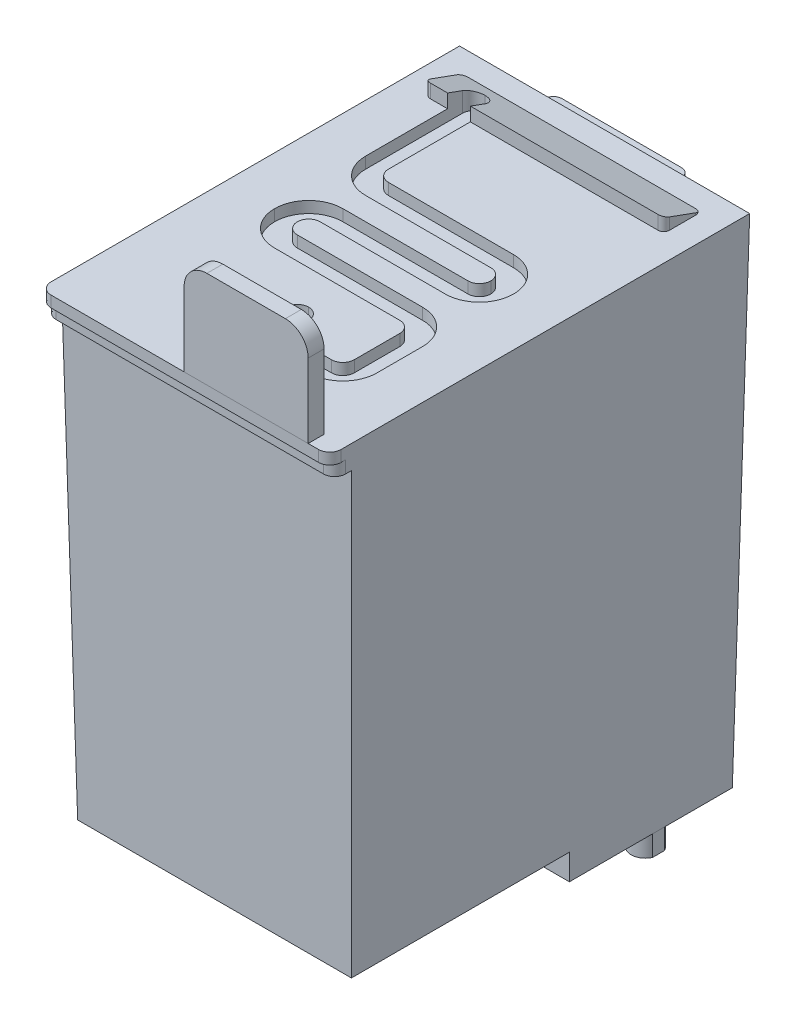
from build123d import *

# Parameters (mm, degrees)
SKETCH1_W                       = 25.5
SKETCH1_H                       = 35
BOSS_EXTRUDE1_DEPTH             = 41.4
BOSS_EXTRUDE1_DRAFT             = -1
SKETCH2_W                       = 24.054720624
SKETCH2_H                       = 14.4
BOSS_EXTRUDE2_DEPTH             = 1.9
BOSS_EXTRUDE2_TAPER             = 1
SKETCH3_W                       = 10.4
SKETCH3_H                       = 33.521556001
BOSS_EXTRUDE3_DEPTH             = 1
BOSS_EXTRUDE3_DIRECTION_2_REACH = 50.412
CUT_EXTRUDE1_DEPTH              = 51.901301712
SKETCH5_W                       = 10.4
SKETCH5_H                       = 18.004100936
BOSS_EXTRUDE4_DEPTH             = 0.4
CUT_EXTRUDE2_DEPTH              = 52.249805034
SKETCH7_W                       = 7
SKETCH7_H                       = 4.5
CUT_EXTRUDE3_DEPTH              = 3.3
SKETCH8_W                       = 8.4
SKETCH8_H                       = 25.004100936
CUT_EXTRUDE4_DEPTH              = 1.3
SKETCH9_W                       = 2.3
SKETCH9_H                       = 14.333670754
BOSS_EXTRUDE5_DEPTH             = 0.4
BOSS_EXTRUDE5_DRAFT             = 1
BOSS_EXTRUDE5_PROFILE_2_DEPTH   = 0.4
BOSS_EXTRUDE5_PROFILE_2_DRAFT   = 1
BOSS_EXTRUDE6_START             = -6.461525
SKETCH10_R                      = 1.25
BOSS_EXTRUDE6_DEPTH             = 8.261525
SKETCH11_W                      = 12
SKETCH11_H                      = 1.1
BOSS_EXTRUDE7_DEPTH             = 19
FILLET1_R                       = 0.75
BOSS_EXTRUDE8_DEPTH             = 1.5
CHAMFER1_SIZE                   = 1.5
CHAMFER1_SIZE_2                 = 4.121216129
BOSS_EXTRUDE9_DEPTH             = 1
BOSS_EXTRUDE9_DRAFT             = -1
BOSS_EXTRUDE10_DEPTH            = 2.1
BOSS_EXTRUDE10_DRAFT            = -1
SKETCH15_W                      = 10.9
SKETCH15_H                      = 1.4
BOSS_EXTRUDE11_DEPTH            = 8.5
FILLET2_R                       = 2
CUT_EXTRUDE5_DEPTH              = 52.08005971
CUT_EXTRUDE5_DEPTH_BACK         = 1
FILLET3_R                       = 1
FILLET4_R                       = 3
SKETCH17_W                      = 6.5
SKETCH17_H                      = 24.604100936
BOSS_EXTRUDE12_DEPTH            = 1
SKETCH18_W                      = 4.4
SKETCH18_H                      = 7.5
BOSS_EXTRUDE13_DEPTH            = 0.1
SKETCH19_W                      = 1
SKETCH19_H                      = 0.85
BOSS_EXTRUDE14_DEPTH            = 0.1


# Some blends are built 0.0001 mm under size
with BuildPart() as part:
    # Sketch1 → Boss-Extrude1 (with draft: the straight prism first)
    with BuildSketch(Plane(origin=(0, 0, 0), x_dir=(1, 0, 0), z_dir=(0, 1, 0))):
        Rectangle(SKETCH1_W, SKETCH1_H)
    extrude(amount=-BOSS_EXTRUDE1_DEPTH)
    # Boss-Extrude1: the draft: its side faces are tilted about the plane it starts from
    boss_extrude1_sides = [part.faces().sort_by_distance(p)[0] for p in [
        (-12.75, -20.7, 0),
        (0, -20.7, 17.5),
        (12.75, -20.7, 0),
        (0, -20.7, -17.5),
    ]]
    draft(boss_extrude1_sides, Plane(origin=(0, 0, 0), x_dir=(1, 0, 0), z_dir=(0, 1, 0)), BOSS_EXTRUDE1_DRAFT)

    # Sketch2 → Boss-Extrude2 (add)
    with BuildSketch(Plane.XZ.offset(41.4)):
        with Locations((0, -9.577360312)):
            Rectangle(SKETCH2_W, SKETCH2_H)
    extrude(amount=BOSS_EXTRUDE2_DEPTH, taper=BOSS_EXTRUDE2_TAPER)

    # Sketch3 → Boss-Extrude3 (add)
    with BuildSketch(Plane.XZ.offset(43.3)):
        with Locations((0, 0.016582312)):
            Rectangle(SKETCH3_W, SKETCH3_H)
    extrude(amount=BOSS_EXTRUDE3_DEPTH)

    # Sketch3 → Boss-Extrude3 direction 2 (add, up to next)
    with BuildSketch(Plane.XZ.offset(43.3), mode=Mode.PRIVATE) as boss_extrude3_direction_2_sk1:
        with Locations((0, 0.016582312)):
            Rectangle(SKETCH3_W, SKETCH3_H)
    boss_extrude3_direction_2_tool1 = extrude(boss_extrude3_direction_2_sk1.sketch, amount=-BOSS_EXTRUDE3_DIRECTION_2_REACH, mode=Mode.PRIVATE) - part.part
    add(boss_extrude3_direction_2_tool1.solids().sort_by_distance((0, -43.3, 0.016582))[0])

    # Sketch4 → Cut-Extrude1 (cut, through all)
    with BuildSketch(Plane(origin=(5.2, 0, 0), x_dir=(0, 0, -1), z_dir=(1, 0, 0))):
        Polygon((16.744195689, -43.3), (16.726740624, -44.3), (16.744195689, -44.3), align=None)
    extrude(amount=-CUT_EXTRUDE1_DEPTH, mode=Mode.SUBTRACT)

    # Sketch5 → Boss-Extrude4 (add)
    with BuildSketch(Plane.XZ.offset(44.3)):
        with Locations((0, 7.775309844)):
            Rectangle(SKETCH5_W, SKETCH5_H)
    extrude(amount=BOSS_EXTRUDE4_DEPTH)

    # Sketch6 → Cut-Extrude2 (cut, through all)
    with BuildSketch(Plane(origin=(5.2, 0, 0), x_dir=(0, 0, -1), z_dir=(1, 0, 0))):
        Polygon((-16.777360312, -41.4), (-11.061592647, -44.7), (-16.777360312, -44.7), align=None)
    extrude(amount=-CUT_EXTRUDE2_DEPTH, mode=Mode.SUBTRACT)

    # Sketch7 → Cut-Extrude3 (cut)
    with BuildSketch(Plane.XZ.offset(44.7)):
        with Locations((0, 14.527360312)):
            Rectangle(SKETCH7_W, SKETCH7_H)
    extrude(amount=-CUT_EXTRUDE3_DEPTH, mode=Mode.SUBTRACT)

    # Sketch8 → Cut-Extrude4 (cut)
    with BuildSketch(Plane.XZ.offset(44.7)):
        with Locations((0, -2.224690156)):
            Rectangle(SKETCH8_W, SKETCH8_H)
    extrude(amount=-CUT_EXTRUDE4_DEPTH, mode=Mode.SUBTRACT)


with BuildPart() as boss_extrude5_tool:
    # Sketch9 → Boss-Extrude5 (with draft: the straight prism first)
    with BuildSketch(Plane.XZ.offset(43.3)):
        with Locations((-10.844195689, -9.577360312)):
            Rectangle(SKETCH9_W, SKETCH9_H)
    extrude(amount=BOSS_EXTRUDE5_DEPTH)
    # Boss-Extrude5: the draft: its side faces are tilted about the plane it starts from
    boss_extrude5_sides = [boss_extrude5_tool.faces().sort_by_distance(p)[0] for p in [
        (-11.994195689, -43.5, -9.577360312),
        (-10.844195689, -43.5, -16.744195689),
        (-9.694195689, -43.5, -9.577360312),
        (-10.844195689, -43.5, -2.410524935),
    ]]
    draft(boss_extrude5_sides, Plane.XZ.offset(43.3), BOSS_EXTRUDE5_DRAFT)


with BuildPart() as part_1:
    add(part.part)

    # Boss-Extrude5: add boss_extrude5_tool
    add(boss_extrude5_tool.part)


with BuildPart() as boss_extrude5_profile_2_tool:
    # Sketch9 → Boss-Extrude5 profile 2 (with draft: the straight prism first)
    with BuildSketch(Plane.XZ.offset(43.3)):
        with Locations((10.844195689, -9.577360312)):
            Rectangle(SKETCH9_W, SKETCH9_H)
    extrude(amount=BOSS_EXTRUDE5_PROFILE_2_DEPTH)
    # Boss-Extrude5 profile 2: the draft: its side faces are tilted about the plane it starts from
    boss_extrude5_profile_2_sides = [boss_extrude5_profile_2_tool.faces().sort_by_distance(p)[0] for p in [
        (10.844195689, -43.5, -2.410524935),
        (9.694195689, -43.5, -9.577360312),
        (10.844195689, -43.5, -16.744195689),
        (11.994195689, -43.5, -9.577360312),
    ]]
    draft(boss_extrude5_profile_2_sides, Plane.XZ.offset(43.3), BOSS_EXTRUDE5_PROFILE_2_DRAFT)


with BuildPart() as part_2:
    add(part_1.part)

    # Boss-Extrude5 profile 2: add boss_extrude5_profile_2_tool
    add(boss_extrude5_profile_2_tool.part)

    # Sketch10 → Boss-Extrude6 (add)
    with BuildSketch(Plane.XZ.offset(43.7).offset(BOSS_EXTRUDE6_START)):
        with Locations(Location((-10.85, -10.237213663, 0), (0, 0, 155.47371494))):
            Circle(SKETCH10_R)
        with BuildLine():
            Line((11.987213663, -9.718325346), (11.987213663, -10.75610198))
            ThreePointArc((11.987213663, -10.75610198), (9.6, -10.237213663), (11.987213663, -9.718325346))
        make_face()
    extrude(amount=BOSS_EXTRUDE6_DEPTH)

    # Sketch11 → Boss-Extrude7 (add)
    with BuildSketch(Plane.XY):
        with Locations((0, -1.55)):
            Rectangle(SKETCH11_W, SKETCH11_H)
    extrude(amount=-BOSS_EXTRUDE7_DEPTH)

    # Fillet1
    fillet1_edges = [part_2.edges().sort_by_distance(p)[0] for p in [
        (6, -1.55, -19),
        (-6, -1.55, -19),
    ]]
    fillet(fillet1_edges, radius=FILLET1_R)

    # Sketch12 → Boss-Extrude8 (add)
    with BuildSketch(Plane(origin=(0, 0, 0), x_dir=(1, 0, 0), z_dir=(0, 1, 0))):
        with BuildLine():
            Line((-10, 15.5), (10, 15.5))
            ThreePointArc((10, 15.5), (10.353553391, 15.353553391), (10.5, 15))
            Line((10.5, 15), (10.5, 12.7))
            ThreePointArc((10.5, 12.7), (10.353553391, 12.346446609), (10, 12.2))
            Line((10, 12.2), (-10, 12.2))
            ThreePointArc((-10, 12.2), (-10.353553391, 12.346446609), (-10.5, 12.7))
            Line((-10.5, 12.7), (-10.5, 15))
            ThreePointArc((-10.5, 15), (-10.353553391, 15.353553391), (-10, 15.5))
        make_face()
    extrude(amount=BOSS_EXTRUDE8_DEPTH)

    # Chamfer1
    # the kernel refuses this chamfer: 4.121216129, 1.5 mm, written as the material it takes off along each edge
    with BuildSketch(Plane(origin=(-20.691237174, 1.5, -15.5), x_dir=(0, -0.9950833631817486, -0.09904090225205064), z_dir=(1, 0, 0))) as chamfer1_piece_1:
        Polygon((CHAMFER1_SIZE * 0.995083363182, -CHAMFER1_SIZE * 0.0990409022521), (-CHAMFER1_SIZE_2 * 0.0990409022564, -CHAMFER1_SIZE_2 * 0.995083363226), (0, 0), align=None)
    extrude(amount=41.382474348, mode=Mode.SUBTRACT)


with BuildPart() as boss_extrude9_tool:
    # Sketch13 → Boss-Extrude9 (with draft: the straight prism first)
    with BuildSketch(Plane(origin=(0, 0, 0), x_dir=(1, 0, 0), z_dir=(0, 1, 0))):
        with BuildLine():
            Line((-12.75, 0), (-12.75, -18.4))
            ThreePointArc((-12.75, -18.4), (-12.457106781, -19.107106781), (-11.75, -19.4))
            Line((-11.75, -19.4), (11.75, -19.4))
            ThreePointArc((11.75, -19.4), (12.457106781, -19.107106781), (12.75, -18.4))
            Line((12.75, -18.4), (12.75, 0))
            Line((12.75, 0), (-12.75, 0))
        make_face()
    extrude(amount=-BOSS_EXTRUDE9_DEPTH)
    # Boss-Extrude9: the draft: its side faces are tilted about the plane it starts from
    boss_extrude9_sides = [boss_extrude9_tool.faces().sort_by_distance(p)[0] for p in [
        (-12.75, -0.5, 9.2),
        (-12.457106781, -0.5, 19.107106781),
        (0, -0.5, 19.4),
        (12.457106781, -0.5, 19.107106781),
        (12.75, -0.5, 9.2),
        (0, -0.5, 0),
    ]]
    draft(boss_extrude9_sides, Plane(origin=(0, 0, 0), x_dir=(1, 0, 0), z_dir=(0, 1, 0)), BOSS_EXTRUDE9_DRAFT)


with BuildPart() as part_3:
    add(part_2.part)

    # Boss-Extrude9: add boss_extrude9_tool
    add(boss_extrude9_tool.part)


with BuildPart() as boss_extrude10_tool:
    # Sketch14 → Boss-Extrude10 (with draft: the straight prism first)
    with BuildSketch(Plane(origin=(0, 0, 0), x_dir=(1, 0, 0), z_dir=(0, 1, 0))):
        with BuildLine():
            Line((-12.75, -0.45), (-12.75, -17.982544935))
            ThreePointArc((-12.75, -17.982544935), (-12.457106781, -18.689651716), (-11.75, -18.982544935))
            Line((-11.75, -18.982544935), (11.75, -18.982544935))
            ThreePointArc((11.75, -18.982544935), (12.457106781, -18.689651716), (12.75, -17.982544935))
            Line((12.75, -17.982544935), (12.75, -0.45))
            Line((12.75, -0.45), (-12.75, -0.45))
        make_face()
    extrude(amount=-BOSS_EXTRUDE10_DEPTH)
    # Boss-Extrude10: the draft: its side faces are tilted about the plane it starts from
    boss_extrude10_sides = [boss_extrude10_tool.faces().sort_by_distance(p)[0] for p in [
        (-12.75, -1.05, 9.216272468),
        (-12.457106781, -1.05, 18.689651716),
        (0, -1.05, 18.982544935),
        (12.457106781, -1.05, 18.689651716),
        (12.75, -1.05, 9.216272468),
        (0, -1.05, 0.45),
    ]]
    draft(boss_extrude10_sides, Plane(origin=(0, 0, 0), x_dir=(1, 0, 0), z_dir=(0, 1, 0)), BOSS_EXTRUDE10_DRAFT)


with BuildPart() as part_4:
    add(part_3.part)

    # Boss-Extrude10: add boss_extrude10_tool
    add(boss_extrude10_tool.part)

    # Sketch15 → Boss-Extrude11 (add)
    with BuildSketch(Plane(origin=(0, 0, 0), x_dir=(1, 0, 0), z_dir=(0, 1, 0))):
        with Locations((5.4, -18.7)):
            Rectangle(SKETCH15_W, SKETCH15_H)
    extrude(amount=BOSS_EXTRUDE11_DEPTH)

    # Fillet2
    fillet2_edges = [part_4.edges().sort_by_distance(p)[0] for p in [
        (10.85, 8.5, 18.7),
        (-0.05, 8.5, 18.7),
    ]]
    fillet(fillet2_edges, radius=FILLET2_R)

    # Sketch16 → Cut-Extrude5 (cut, two sides: drawn at the far end of the back side and taken through both)
    with BuildSketch(Plane(origin=(0, 0, 0), x_dir=(1, 0, 0), z_dir=(0, 1, 0)).offset(-CUT_EXTRUDE5_DEPTH_BACK)):
        Polygon((-8.5, 14.5), (-8.5, 2), (6.5, 2), (6.5, 0), (-8.5, 0), (-8.5, -6), (6.5, -6), (6.5, -12), (1.5, -12), (1.5, -9), (-0.5, -9), (-0.5, -14), (8.5, -14), (8.5, -4), (-6.5, -4), (-6.5, -2), (8.5, -2), (8.5, 4), (-6.5, 4), (-6.5, 14.5), align=None)
    extrude(amount=CUT_EXTRUDE5_DEPTH + CUT_EXTRUDE5_DEPTH_BACK, mode=Mode.SUBTRACT)

    # Fillet3
    fillet3_edges = [part_4.edges().sort_by_distance(p)[0] for p in [
        (-0.5, -0.5, 9),
        (1.5, -0.5, 9),
        (1.5, -0.5, 12),
        (6.5, -0.5, 12),
        (6.5, -0.5, 6),
        (-6.5, -0.5, 2),
        (-6.5, -0.5, 4),
        (6.5, -0.5, 0),
        (6.5, -0.5, -2),
        (-6.5, -0.5, -4),
        (-8.5, -0.318014883, -14.5),
        (-6.5, -0.318014883, -14.5),
    ]]
    fillet(fillet3_edges, radius=FILLET3_R - 0.0001)  # a hair under: the kernel refuses the full size

    # Fillet4
    fillet4_edges = [part_4.edges().sort_by_distance(p)[0] for p in [
        (-8.5, -0.5, -2),
        (-8.5, -0.5, 0),
        (-8.5, -0.5, 6),
        (-0.5, -0.5, 14),
        (8.5, -0.5, 14),
        (8.5, -0.5, 4),
        (8.5, -0.5, 2),
        (8.5, -0.5, -4),
    ]]
    fillet(fillet4_edges, radius=FILLET4_R - 0.0001)  # a hair under: the kernel refuses the full size

    # Sketch17 → Boss-Extrude12 (add)
    with BuildSketch(Plane.XZ.offset(43.4)):
        with Locations((0, -2.224690156)):
            Rectangle(SKETCH17_W, SKETCH17_H)
    extrude(amount=BOSS_EXTRUDE12_DEPTH)

    # Sketch18 → Boss-Extrude13 (add)
    with BuildSketch(Plane.XZ.offset(44.4)):
        with Locations((0.85, 6.127360312)):
            Rectangle(SKETCH18_W, SKETCH18_H)
    extrude(amount=BOSS_EXTRUDE13_DEPTH)

    # Sketch19 → Boss-Extrude14 (add)
    with BuildSketch(Plane.XZ.offset(44.4)):
        with Locations((-2.65, -13.901740624)):
            Rectangle(SKETCH19_W, SKETCH19_H)
        with Locations((2.3, -13.901740624)):
            Rectangle(SKETCH19_W, SKETCH19_H)
        with Locations((-2.65, -12.510073957)):
            Rectangle(SKETCH19_W, SKETCH19_H)
        with Locations((-2.65, -11.11840729)):
            Rectangle(SKETCH19_W, SKETCH19_H)
        with Locations((-2.65, -9.726740624)):
            Rectangle(SKETCH19_W, SKETCH19_H)
        with Locations((-2.65, -8.335073957)):
            Rectangle(SKETCH19_W, SKETCH19_H)
        with Locations((-2.65, -6.94340729)):
            Rectangle(SKETCH19_W, SKETCH19_H)
        with Locations((-2.65, -5.551740624)):
            Rectangle(SKETCH19_W, SKETCH19_H)
        with Locations((2.3, -12.510073957)):
            Rectangle(SKETCH19_W, SKETCH19_H)
        with Locations((2.3, -11.11840729)):
            Rectangle(SKETCH19_W, SKETCH19_H)
        with Locations((2.3, -9.726740624)):
            Rectangle(SKETCH19_W, SKETCH19_H)
        with Locations((2.3, -8.335073957)):
            Rectangle(SKETCH19_W, SKETCH19_H)
        Polygon((1.8, -6.51840729), (1.8, -7.36840729), (2.8, -7.36840729), (2.8, -6.51840729), (2.8, -5.976740624), (2.8, -5.126740624), (1.8, -5.126740624), (1.8, -5.976740624), align=None)
    extrude(amount=BOSS_EXTRUDE14_DEPTH)


solid = part_4.part
